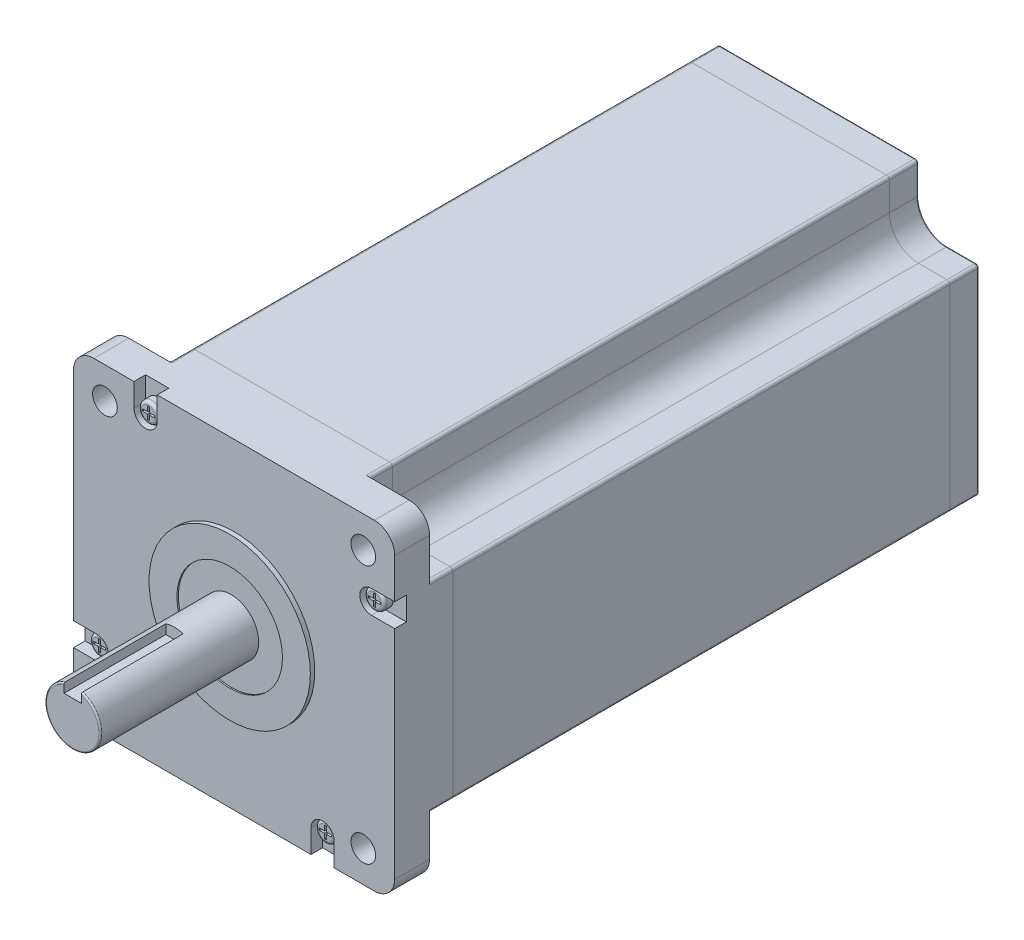
from build123d import *
from OCP.BRepFilletAPI import BRepFilletAPI_MakeChamfer

# Parameters (mm, degrees)
SKETCH1_R                = 4.25
BOSS_EXTRUDE1_DEPTH      = 201
SKETCH2_R                = 27.75
BOSS_EXTRUDE2_DEPTH      = 1.52
BOSS_EXTRUDE3_DEPTH      = 54
BOSS_EXTRUDE3_DEPTH_BACK = 1
SKETCH3_R                = 9.5
CUT_EXTRUDE1_DEPTH       = 10
CUT_EXTRUDE1_DEPTH_BACK  = 35
SKETCH4_W                = 6
SKETCH4_H                = 6
FILLET1_R                = 0.5
SKETCH5_R                = 18.150459798
CUT_EXTRUDE2_DEPTH       = 0.5
CUT_EXTRUDE3_DEPTH       = 189
MIRROR2_COPY_1_DEPTH     = 189
FILLET2_R                = 0.5
FILLET3_R                = 1
SKETCH8_R                = 17.5
CUT_EXTRUDE4_DEPTH       = 1
SKETCH9_R                = 9.5
BOSS_EXTRUDE4_DEPTH      = 0.8
CUT_EXTRUDE5_DEPTH       = 4
SKETCH11_R               = 3.434192677
BOSS_EXTRUDE5_DEPTH      = 3
FILLET4_R                = 1
CUT_EXTRUDE6_DEPTH       = 2
CUT_EXTRUDE6_DRAFT       = -6
CHAMFER2_SIZE            = 1.5
CHAMFER2_SIZE2           = 1.685405696
CIRPATTERN3_COUNT        = 4


with BuildPart() as part:
    # Sketch1 → Boss-Extrude1 (new body)
    with BuildSketch(Plane.XY):
        with BuildLine():
            Line((-48.25, -55.25), (48.25, -55.25))
            ThreePointArc((48.25, -55.25), (53.199747468, -53.199747468), (55.25, -48.25))
            Line((55.25, -48.25), (55.25, 48.25))
            ThreePointArc((55.25, 48.25), (53.199747468, 53.199747468), (48.25, 55.25))
            Line((48.25, 55.25), (-48.25, 55.25))
            ThreePointArc((-48.25, 55.25), (-53.199747468, 53.199747468), (-55.25, 48.25))
            Line((-55.25, 48.25), (-55.25, -48.25))
            ThreePointArc((-55.25, -48.25), (-53.199747468, -53.199747468), (-48.25, -55.25))
        make_face()
        with Locations((-44.45, 44.45)):
            Circle(SKETCH1_R, mode=Mode.SUBTRACT)
        with Locations((44.45, 44.45)):
            Circle(SKETCH1_R, mode=Mode.SUBTRACT)
        with Locations((-44.45, -44.45)):
            Circle(SKETCH1_R, mode=Mode.SUBTRACT)
        with Locations((44.45, -44.45)):
            Circle(SKETCH1_R, mode=Mode.SUBTRACT)
    extrude(amount=BOSS_EXTRUDE1_DEPTH)

    # Sketch2 → Boss-Extrude2 (add)
    with BuildSketch(Plane.XY.offset(201)):
        Circle(SKETCH2_R)
    extrude(amount=BOSS_EXTRUDE2_DEPTH)

    # Sketch5 → Cut-Extrude2 (cut)
    with BuildSketch(Plane.XY.offset(202.52)):
        Circle(SKETCH5_R)
    extrude(amount=-CUT_EXTRUDE2_DEPTH, mode=Mode.SUBTRACT)

    # Sketch6 → Cut-Extrude3 (cut)
    with BuildSketch(Plane(origin=(0, 0, 0), x_dir=(-1, 0, 0), z_dir=(0, 0, -1))):
        with BuildLine():
            Line((55.25, -34.45), (44.45, -34.45))
            ThreePointArc((44.45, -34.45), (37.378932188, -37.378932188), (34.45, -44.45))
            Line((34.45, -44.45), (34.45, -55.25))
            Line((34.45, -55.25), (48.25, -55.25))
            ThreePointArc((48.25, -55.25), (53.199747468, -53.199747468), (55.25, -48.25))
            Line((55.25, -48.25), (55.25, -34.45))
        make_face()
    cut_extrude3 = extrude(amount=-CUT_EXTRUDE3_DEPTH, mode=Mode.SUBTRACT)

    # Mirror1: Cut-Extrude3 across plane
    add(cut_extrude3.mirror(Plane(origin=(0, 0, 0), x_dir=(0, 0, 1), z_dir=(1, 0, 0))), mode=Mode.SUBTRACT)

    # Mirror2: Cut-Extrude3 across plane
    add(cut_extrude3.mirror(Plane.ZX), mode=Mode.SUBTRACT)

    # Mirror2 copy 1 sketch → Mirror2 copy 1 (cut)
    with BuildSketch(Plane(origin=(0, 0, 0), x_dir=(1, 0, 0), z_dir=(0, 0, -1))):
        with BuildLine():
            Line((55.25, -34.45), (44.45, -34.45))
            ThreePointArc((44.45, -34.45), (37.378932188, -37.378932188), (34.45, -44.45))
            Line((34.45, -44.45), (34.45, -55.25))
            Line((34.45, -55.25), (48.25, -55.25))
            ThreePointArc((48.25, -55.25), (53.199747468, -53.199747468), (55.25, -48.25))
            Line((55.25, -48.25), (55.25, -34.45))
        make_face()
    extrude(amount=-MIRROR2_COPY_1_DEPTH, mode=Mode.SUBTRACT)

    # Fillet2
    fillet2_edges = [part.edges().sort_by_distance(p)[0] for p in [
        (-55.25, 0, 0),
        (-49.85, 34.45, 0),
        (-37.378932188, 37.378932188, 0),
        (-34.45, 49.85, 0),
        (0, -55.25, 0),
        (-49.85, -34.45, 0),
        (-37.378932188, -37.378932188, 0),
        (-34.45, -49.85, 0),
        (55.25, 0, 0),
        (49.85, -34.45, 0),
        (37.378932188, -37.378932188, 0),
        (34.45, -49.85, 0),
        (0, 55.25, 0),
        (49.85, 34.45, 0),
        (37.378932188, 37.378932188, 0),
        (34.45, 49.85, 0),
    ]]
    fillet(fillet2_edges, radius=FILLET2_R)

    # Fillet3
    # the kernel refuses this fillet: 1 mm, written as the material it takes off along each edge
    with BuildSketch(Plane(origin=(54.25, 33.45, 0), x_dir=(0, 1, 0), z_dir=(-1, 0, 0))) as fillet3_piece_1:
        with BuildLine():
            CenterArc((0.5, -0.5), 0.5, 0, 90)
            Line((1, -0.5), (1, 0))
            Line((1, 0), (0.5, 0))
        make_face()
    revolve(axis=Axis((54.25, 33.45, 0), (0, 0, -1)), revolution_arc=90, mode=Mode.SUBTRACT)
    with BuildSketch(Plane(origin=(54.25, -33.45, 0), x_dir=(1, 0, 0), z_dir=(0, 1, 0))) as fillet3_piece_2:
        with BuildLine():
            CenterArc((0.5, -0.5), 0.5, 0, 90)
            Line((1, -0.5), (1, 0))
            Line((1, 0), (0.5, 0))
        make_face()
    revolve(axis=Axis((54.25, -33.45, 0), (0, 0, -1)), revolution_arc=90, mode=Mode.SUBTRACT)
    with BuildSketch(Plane(origin=(33.45, 54.25, 0), x_dir=(0, 1, 0), z_dir=(-1, 0, 0))) as fillet3_piece_3:
        with BuildLine():
            CenterArc((0.5, -0.5), 0.5, 0, 90)
            Line((1, -0.5), (1, 0))
            Line((1, 0), (0.5, 0))
        make_face()
    revolve(axis=Axis((33.45, 54.25, 0), (0, 0, -1)), revolution_arc=90, mode=Mode.SUBTRACT)
    with BuildSketch(Plane(origin=(33.45, -54.25, 0), x_dir=(1, 0, 0), z_dir=(0, 1, 0))) as fillet3_piece_4:
        with BuildLine():
            CenterArc((0.5, -0.5), 0.5, 0, 90)
            Line((1, -0.5), (1, 0))
            Line((1, 0), (0.5, 0))
        make_face()
    revolve(axis=Axis((33.45, -54.25, 0), (0, 0, -1)), revolution_arc=90, mode=Mode.SUBTRACT)
    with BuildSketch(Plane(origin=(-33.45, 54.25, 0), x_dir=(-1, 0, 0), z_dir=(0, -1, 0))) as fillet3_piece_5:
        with BuildLine():
            CenterArc((0.5, -0.5), 0.5, 0, 90)
            Line((1, -0.5), (1, 0))
            Line((1, 0), (0.5, 0))
        make_face()
    revolve(axis=Axis((-33.45, 54.25, 0), (0, 0, -1)), revolution_arc=90, mode=Mode.SUBTRACT)
    with BuildSketch(Plane(origin=(-33.45, -54.25, 0), x_dir=(0, -1, 0), z_dir=(1, 0, 0))) as fillet3_piece_6:
        with BuildLine():
            CenterArc((0.5, -0.5), 0.5, 0, 90)
            Line((1, -0.5), (1, 0))
            Line((1, 0), (0.5, 0))
        make_face()
    revolve(axis=Axis((-33.45, -54.25, 0), (0, 0, -1)), revolution_arc=90, mode=Mode.SUBTRACT)
    with BuildSketch(Plane(origin=(-54.25, 33.45, 0), x_dir=(-1, 0, 0), z_dir=(0, -1, 0))) as fillet3_piece_7:
        with BuildLine():
            CenterArc((0.5, -0.5), 0.5, 0, 90)
            Line((1, -0.5), (1, 0))
            Line((1, 0), (0.5, 0))
        make_face()
    revolve(axis=Axis((-54.25, 33.45, 0), (0, 0, -1)), revolution_arc=90, mode=Mode.SUBTRACT)
    with BuildSketch(Plane(origin=(-54.25, -33.45, 0), x_dir=(0, -1, 0), z_dir=(1, 0, 0))) as fillet3_piece_8:
        with BuildLine():
            CenterArc((0.5, -0.5), 0.5, 0, 90)
            Line((1, -0.5), (1, 0))
            Line((1, 0), (0.5, 0))
        make_face()
    revolve(axis=Axis((-54.25, -33.45, 0), (0, 0, -1)), revolution_arc=90, mode=Mode.SUBTRACT)
    with BuildSketch(Plane(origin=(-55.25, 34.45, 0), x_dir=(0, -1, 0), z_dir=(0, 0, 1)), Plane(origin=(-55.25, -34.45, 0), x_dir=(1, 0, 0), z_dir=(0, 0, 1)), Plane(origin=(34.45, 55.25, 0), x_dir=(-1, 0, 0), z_dir=(0, 0, 1)), Plane(origin=(-34.45, -55.25, 0), x_dir=(1, 0, 0), z_dir=(0, 0, 1))) as fillet3_piece_9:
        with BuildLine():
            CenterArc((FILLET3_R, FILLET3_R), FILLET3_R, 180, 90)
            Line((0, FILLET3_R), (0, 0))
            Line((0, 0), (FILLET3_R, 0))
        make_face()
    extrude(amount=189, mode=Mode.SUBTRACT)
    with BuildSketch(Plane(origin=(-34.45, 55.25, 0), x_dir=(1, 0, 0), z_dir=(0, 0, 1)), Plane(origin=(55.25, 34.45, 0), x_dir=(0, -1, 0), z_dir=(0, 0, 1)), Plane(origin=(55.25, -34.45, 0), x_dir=(-1, 0, 0), z_dir=(0, 0, 1)), Plane(origin=(34.45, -55.25, 0), x_dir=(-1, 0, 0), z_dir=(0, 0, 1))) as fillet3_piece_10:
        with BuildLine():
            CenterArc((FILLET3_R, -FILLET3_R), FILLET3_R, 90, 90)
            Line((0, -FILLET3_R), (0, 0))
            Line((0, 0), (FILLET3_R, 0))
        make_face()
    extrude(amount=189, mode=Mode.SUBTRACT)

    # Sketch8 → Cut-Extrude4 (cut)
    with BuildSketch(Plane(origin=(0, 0, 0), x_dir=(-1, 0, 0), z_dir=(0, 0, -1))):
        Circle(SKETCH8_R)
    extrude(amount=-CUT_EXTRUDE4_DEPTH, mode=Mode.SUBTRACT)

    # Sketch10 → Cut-Extrude5 (cut)
    with BuildSketch(Plane.XY.offset(201)):
        with BuildLine():
            Line((-34.45, 47.25), (-34.45, 55.25))
            Line((-34.45, 55.25), (-26.45, 55.25))
            Line((-26.45, 55.25), (-26.45, 47.25))
            ThreePointArc((-26.45, 47.25), (-30.45, 43.25), (-34.45, 47.25))
        make_face()
        with BuildLine():
            Line((47.25, 34.45), (55.25, 34.45))
            Line((55.25, 34.45), (55.25, 26.45))
            Line((55.25, 26.45), (47.25, 26.45))
            ThreePointArc((47.25, 26.45), (43.25, 30.45), (47.25, 34.45))
        make_face()
        with BuildLine():
            Line((34.45, -47.25), (34.45, -55.25))
            Line((34.45, -55.25), (26.45, -55.25))
            Line((26.45, -55.25), (26.45, -47.25))
            ThreePointArc((26.45, -47.25), (30.45, -43.25), (34.45, -47.25))
        make_face()
        with BuildLine():
            Line((-47.25, -34.45), (-55.25, -34.45))
            Line((-55.25, -34.45), (-55.25, -26.45))
            Line((-55.25, -26.45), (-47.25, -26.45))
            ThreePointArc((-47.25, -26.45), (-43.25, -30.45), (-47.25, -34.45))
        make_face()
    extrude(amount=-CUT_EXTRUDE5_DEPTH, mode=Mode.SUBTRACT)


with BuildPart() as body_2:
    # Sketch3 → Boss-Extrude3 (new, two sides: drawn at the far end of the back side and taken through both)
    with BuildSketch(Plane.XY.offset(202.52).offset(-BOSS_EXTRUDE3_DEPTH_BACK)):
        Circle(SKETCH3_R)
    extrude(amount=BOSS_EXTRUDE3_DEPTH + BOSS_EXTRUDE3_DEPTH_BACK)

    # Sketch4 → Cut-Extrude1 (cut, two sides: drawn at the far end of the back side and taken through both)
    with BuildSketch(Plane.XY.offset(256.52).offset(-CUT_EXTRUDE1_DEPTH_BACK)):
        with Locations((0, 8.813878189)):
            Rectangle(SKETCH4_W, SKETCH4_H)
    extrude(amount=CUT_EXTRUDE1_DEPTH + CUT_EXTRUDE1_DEPTH_BACK, mode=Mode.SUBTRACT)

    # Fillet1
    fillet1_edges = [body_2.edges().sort_by_distance(p)[0] for p in [
        (-5.556527693, -7.705517504, 256.52),
    ]]
    fillet(fillet1_edges, radius=FILLET1_R)


with BuildPart() as body_3:
    # Sketch9 → Boss-Extrude4 (new body)
    with BuildSketch(Plane(origin=(0, 0, 1), x_dir=(-1, 0, 0), z_dir=(0, 0, -1))):
        Circle(SKETCH9_R)
    extrude(amount=BOSS_EXTRUDE4_DEPTH)


with BuildPart() as body_4:
    # Sketch11 → Boss-Extrude5 (new body)
    with BuildSketch(Plane.XY.offset(197)):
        with Locations((-30.45, 47.25)):
            Circle(SKETCH11_R)
    extrude(amount=BOSS_EXTRUDE5_DEPTH)

    # Fillet4
    fillet4_edges = [body_4.edges().sort_by_distance(p)[0] for p in [
        (-33.884192677, 47.25, 200),
    ]]
    fillet(fillet4_edges, radius=FILLET4_R)


with BuildPart() as cut_extrude6_tool:
    # Sketch12 → Cut-Extrude6 (with draft: the straight prism first)
    with BuildSketch(Plane.XY.offset(200)):
        Polygon((-30.099677189, 47.599957248), (-30.099677189, 49.30926981), (-30.800322811, 49.30926981), (-30.800322811, 47.599957248), (-32.507120955, 47.599957248), (-32.507120955, 46.900042752), (-30.800322811, 46.900042752), (-30.800322811, 45.19073019), (-30.099677189, 45.19073019), (-30.099677189, 46.900042752), (-28.392879045, 46.900042752), (-28.392879045, 47.599957248), align=None)
    extrude(amount=-CUT_EXTRUDE6_DEPTH)
    # Cut-Extrude6: the draft: its side faces are tilted about the plane it starts from
    cut_extrude6_sides = [cut_extrude6_tool.faces().sort_by_distance(p)[0] for p in [
        (-30.099677189, 48.454613529, 199),
        (-30.45, 49.30926981, 199),
        (-30.800322811, 48.454613529, 199),
        (-31.653721883, 47.599957248, 199),
        (-32.507120955, 47.25, 199),
        (-31.653721883, 46.900042752, 199),
        (-30.800322811, 46.045386471, 199),
        (-30.45, 45.19073019, 199),
        (-30.099677189, 46.045386471, 199),
        (-29.246278117, 46.900042752, 199),
        (-28.392879045, 47.25, 199),
        (-29.246278117, 47.599957248, 199),
    ]]
    draft(cut_extrude6_sides, Plane.XY.offset(200), CUT_EXTRUDE6_DRAFT)


with BuildPart() as body_4_1:
    add(body_4.part)

    # Cut-Extrude6: cut by cut_extrude6_tool
    add(cut_extrude6_tool.part, mode=Mode.SUBTRACT)

    # Chamfer2: one chamfer whose edges measure the first distance from different faces: ONE call of the kernel's chamfer builder (chamfer() names one face for all edges)
    chamfer2_edges_1 = [body_4_1.edges().sort_by_distance(p)[0] for p in [
        (-28.603087516, 47.25, 198),
    ]]
    chamfer2_side_1 = [body_4_1.faces().sort_by_distance(p)[0] for p in [
        (-28.482944462, 47.25, 199.143084803),
    ]]
    chamfer2_edges_2 = [body_4_1.edges().sort_by_distance(p)[0] for p in [
        (-30.45, 45.40093866, 198),
    ]]
    chamfer2_side_2 = [body_4_1.faces().sort_by_distance(p)[0] for p in [
        (-30.45, 45.280818025, 199.142871497),
    ]]
    chamfer2_edges_3 = [body_4_1.edges().sort_by_distance(p)[0] for p in [
        (-32.296912484, 47.25, 198),
    ]]
    chamfer2_side_3 = [body_4_1.faces().sort_by_distance(p)[0] for p in [
        (-32.417055538, 47.25, 199.143084803),
    ]]
    chamfer2_edges_4 = [body_4_1.edges().sort_by_distance(p)[0] for p in [
        (-30.45, 49.09906134, 198),
    ]]
    chamfer2_side_4 = [body_4_1.faces().sort_by_distance(p)[0] for p in [
        (-30.45, 49.219181975, 199.142871497),
    ]]
    chamfer2 = BRepFilletAPI_MakeChamfer(body_4_1.part.solid().wrapped)
    for e in chamfer2_edges_1:
        chamfer2.Add(CHAMFER2_SIZE, CHAMFER2_SIZE2, e.wrapped, chamfer2_side_1[0].wrapped)  # the first distance lies on this face
    for e in chamfer2_edges_2:
        chamfer2.Add(CHAMFER2_SIZE, CHAMFER2_SIZE2, e.wrapped, chamfer2_side_2[0].wrapped)  # the first distance lies on this face
    for e in chamfer2_edges_3:
        chamfer2.Add(CHAMFER2_SIZE, CHAMFER2_SIZE2, e.wrapped, chamfer2_side_3[0].wrapped)  # the first distance lies on this face
    for e in chamfer2_edges_4:
        chamfer2.Add(CHAMFER2_SIZE, CHAMFER2_SIZE2, e.wrapped, chamfer2_side_4[0].wrapped)  # the first distance lies on this face
    add(Compound.cast(chamfer2.Shape()), mode=Mode.REPLACE)


with BuildPart() as cirpattern3_1:
    # CirPattern3: pattern copy
    add(body_4_1.part.rotate(Axis((0, 0, 0), (0, 0, 1)), 1 * 360 / CIRPATTERN3_COUNT))


with BuildPart() as cirpattern3_2:
    # CirPattern3: pattern copy
    add(body_4_1.part.rotate(Axis((0, 0, 0), (0, 0, 1)), 2 * 360 / CIRPATTERN3_COUNT))


with BuildPart() as cirpattern3_3:
    # CirPattern3: pattern copy
    add(body_4_1.part.rotate(Axis((0, 0, 0), (0, 0, 1)), 3 * 360 / CIRPATTERN3_COUNT))


solid = Compound([part.part, body_2.part, body_3.part, body_4_1.part, cirpattern3_1.part, cirpattern3_2.part, cirpattern3_3.part])
